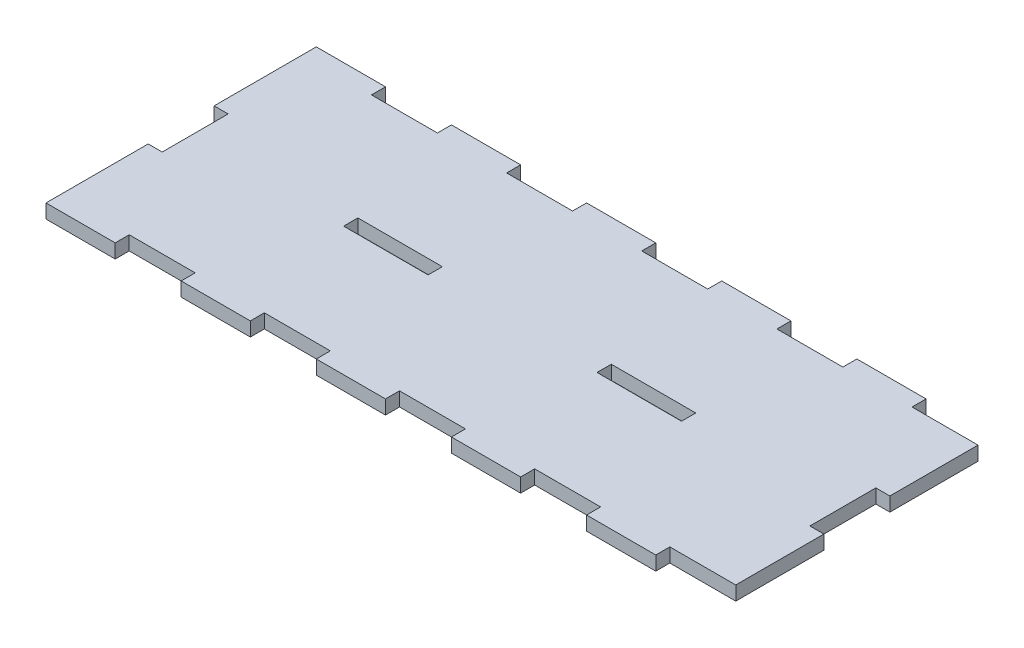
from build123d import *

# Parameters (mm, degrees)
SKETCH1_W           = 200
SKETCH1_H           = 80
BOSS_EXTRUDE1_DEPTH = 4.15
SKETCH4_W           = 4.15
SKETCH4_H           = 19.52
CUT_EXTRUDE3_DEPTH  = 10
SKETCH5_W           = 19.52
SKETCH5_H           = 4.15
CUT_EXTRUDE4_DEPTH  = 10
SKETCH16_W          = 25
SKETCH16_H          = 4.22
CUT_EXTRUDE15_DEPTH = 10


with BuildPart() as part:
    # Sketch1 → Boss-Extrude1 (new body)
    with BuildSketch(Plane(origin=(0, 0, 0), x_dir=(1, 0, 0), z_dir=(0, 1, 0))):
        Rectangle(SKETCH1_W, SKETCH1_H)
    extrude(amount=BOSS_EXTRUDE1_DEPTH)

    # Sketch4 → Cut-Extrude3 (cut)
    with BuildSketch(Plane(origin=(0, 4.15, 0), x_dir=(1, 0, 0), z_dir=(0, 1, 0))):
        with Locations((-97.925, 0)):
            Rectangle(SKETCH4_W, SKETCH4_H)
        with Locations((97.925, 0)):
            Rectangle(SKETCH4_W, SKETCH4_H)
    extrude(amount=-CUT_EXTRUDE3_DEPTH, mode=Mode.SUBTRACT)

    # Sketch5 → Cut-Extrude4 (cut)
    with BuildSketch(Plane(origin=(0, 4.15, 0), x_dir=(1, 0, 0), z_dir=(0, 1, 0))):
        with Locations((90.24, -37.925)):
            Rectangle(SKETCH5_W, SKETCH5_H)
        with Locations((50.24, -37.925)):
            Rectangle(SKETCH5_W, SKETCH5_H)
        with Locations((10.24, -37.925)):
            Rectangle(SKETCH5_W, SKETCH5_H)
        with Locations((-29.76, -37.925)):
            Rectangle(SKETCH5_W, SKETCH5_H)
        with Locations((-69.76, -37.925)):
            Rectangle(SKETCH5_W, SKETCH5_H)
        with Locations((50.24, 37.925)):
            Rectangle(SKETCH5_W, SKETCH5_H)
        with Locations((10.24, 37.925)):
            Rectangle(SKETCH5_W, SKETCH5_H)
        with Locations((-29.76, 37.925)):
            Rectangle(SKETCH5_W, SKETCH5_H)
        with Locations((-69.76, 37.925)):
            Rectangle(SKETCH5_W, SKETCH5_H)
        with Locations((90.24, 37.925)):
            Rectangle(SKETCH5_W, SKETCH5_H)
    extrude(amount=-CUT_EXTRUDE4_DEPTH, mode=Mode.SUBTRACT)

    # Sketch16 → Cut-Extrude15 (cut)
    with BuildSketch(Plane(origin=(0, 4.15, 0), x_dir=(1, 0, 0), z_dir=(0, 1, 0))):
        with Locations((-37.5, 0.198969944)):
            Rectangle(SKETCH16_W, SKETCH16_H)
        with Locations((37.5, 0.198969944)):
            Rectangle(SKETCH16_W, SKETCH16_H)
    extrude(amount=-CUT_EXTRUDE15_DEPTH, mode=Mode.SUBTRACT)


solid = part.part
